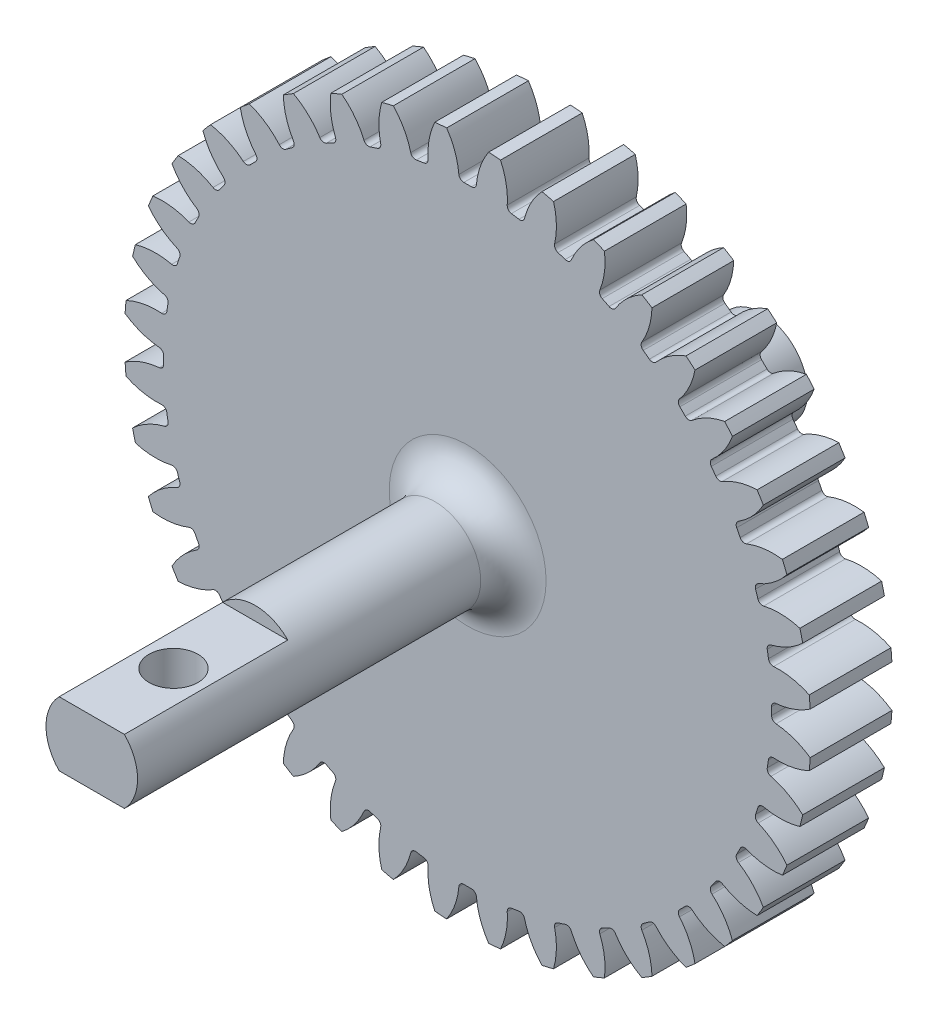
from build123d import *

# Parameters (mm, degrees)
SKETCH1_R                = 21
BOSS_EXTRUDE1_DEPTH      = 2.5
CUT_EXTRUDE1_DEPTH       = 31.116440693
FILLET1_R                = 0.3
CIRPATTERN1_COUNT        = 40
FILLET1_OF_CIRPATTERN1_R = 0.3
CUT_EXTRUDE2_DEPTH       = 31.061577586
CUT_EXTRUDE2_DEPTH_BACK  = 31.061577586
SHAFT_DEPTH              = 13
SHAFT_DEPTH_BACK         = 28
SKETCH5_R                = 2.8
SKETCH7_R                = 2.9
BOSS_EXTRUDE2_DEPTH      = 10
CUT_EXTRUDE5_DEPTH       = 10
SKETCH10_R               = 1.5
CUT_EXTRUDE6_DEPTH       = 8
SKETCH11_R               = 4.251118619
BOSS_EXTRUDE3_DEPTH      = 5
FILLET4_R                = 2
SKETCH12_R               = 5.023784791
SKETCH12_R_2             = 2.8
CUT_EXTRUDE7_DEPTH       = 10


with BuildPart() as part:
    # Sketch1 → Boss-Extrude1 (new, symmetric)
    with BuildSketch(Plane.XY):
        Circle(SKETCH1_R)
    extrude(amount=BOSS_EXTRUDE1_DEPTH, both=True)

    # Sketch3 → Cut-Extrude1 (cut, symmetric)
    with BuildSketch(Plane.XY.offset(2.5)):
        with BuildLine():
            ThreePointArc((-2.139593078, 21.895710572), (-0.970695217, 20.420263648), (-0.519675362, 18.592738839))
            ThreePointArc((-0.519675362, 18.592738839), (0, 18.6), (0.519675362, 18.592738839))
            ThreePointArc((0.519675362, 18.592738839), (0.970695217, 20.420263648), (2.139593078, 21.895710572))
            ThreePointArc((2.139593078, 21.895710572), (0, 22), (-2.139593078, 21.895710572))
        make_face()
    cut_extrude1 = extrude(amount=CUT_EXTRUDE1_DEPTH, both=True, mode=Mode.SUBTRACT)

    # Fillet1
    fillet1_edges = [part.edges().sort_by_distance(p)[0] for p in [
        (0.519675362, 18.592738839, 0),
        (-0.519675362, 18.592738839, 0),
    ]]
    fillet(fillet1_edges, radius=FILLET1_R)

    # CirPattern1: Cut-Extrude1 ×40 about axis
    cirpattern1_axis = Axis((0, 0, 2.5), (0, 0, -1))
    for i in range(1, CIRPATTERN1_COUNT):
        add(cut_extrude1.rotate(cirpattern1_axis, i * 360 / CIRPATTERN1_COUNT), mode=Mode.SUBTRACT)

    # Fillet1 of CirPattern1
    fillet1_of_cirpattern1_edges = [part.edges().sort_by_distance(p)[0] for p in [
        (3.42182245, 18.282536233, 0),
        (2.395267858, 18.445126508, 0),
        (6.239712913, 17.52215691, 0),
        (5.251231633, 17.843333947, 0),
        (8.903960935, 16.33032393, 0),
        (7.977892658, 16.802179285, 0),
        (11.348963889, 14.736384178, 0),
        (10.508111489, 15.347299206, 0),
        (13.514517686, 12.779585741, 0),
        (12.779585741, 13.514517686, 0),
        (15.347299206, 10.508111489, 0),
        (14.736384178, 11.348963889, 0),
        (16.802179285, 7.977892658, 0),
        (16.33032393, 8.903960935, 0),
        (17.843333947, 5.251231633, 0),
        (17.52215691, 6.239712913, 0),
        (18.445126508, 2.395267858, 0),
        (18.282536233, 3.42182245, 0),
        (18.592738839, -0.519675362, 0),
        (18.592738839, 0.519675362, 0),
        (18.282536233, -3.42182245, 0),
        (18.445126508, -2.395267858, 0),
        (17.52215691, -6.239712913, 0),
        (17.843333947, -5.251231633, 0),
        (16.33032393, -8.903960935, 0),
        (16.802179285, -7.977892658, 0),
        (14.736384178, -11.348963889, 0),
        (15.347299206, -10.508111489, 0),
        (12.779585741, -13.514517686, 0),
        (13.514517686, -12.779585741, 0),
        (10.508111489, -15.347299206, 0),
        (11.348963889, -14.736384178, 0),
        (7.977892658, -16.802179285, 0),
        (8.903960935, -16.33032393, 0),
        (5.251231633, -17.843333947, 0),
        (6.239712913, -17.52215691, 0),
        (2.395267858, -18.445126508, 0),
        (3.42182245, -18.282536233, 0),
        (-0.519675362, -18.592738839, 0),
        (0.519675362, -18.592738839, 0),
        (-3.42182245, -18.282536233, 0),
        (-2.395267858, -18.445126508, 0),
        (-6.239712913, -17.52215691, 0),
        (-5.251231633, -17.843333947, 0),
        (-8.903960935, -16.33032393, 0),
        (-7.977892658, -16.802179285, 0),
        (-11.348963889, -14.736384178, 0),
        (-10.508111489, -15.347299206, 0),
        (-13.514517686, -12.779585741, 0),
        (-12.779585741, -13.514517686, 0),
        (-15.347299206, -10.508111489, 0),
        (-14.736384178, -11.348963889, 0),
        (-16.802179285, -7.977892658, 0),
        (-16.33032393, -8.903960935, 0),
        (-17.843333947, -5.251231633, 0),
        (-17.52215691, -6.239712913, 0),
        (-18.445126508, -2.395267858, 0),
        (-18.282536233, -3.42182245, 0),
        (-18.592738839, 0.519675362, 0),
        (-18.592738839, -0.519675362, 0),
        (-18.282536233, 3.42182245, 0),
        (-18.445126508, 2.395267858, 0),
        (-17.52215691, 6.239712913, 0),
        (-17.843333947, 5.251231633, 0),
        (-16.33032393, 8.903960935, 0),
        (-16.802179285, 7.977892658, 0),
        (-14.736384178, 11.348963889, 0),
        (-15.347299206, 10.508111489, 0),
        (-12.779585741, 13.514517686, 0),
        (-13.514517686, 12.779585741, 0),
        (-10.508111489, 15.347299206, 0),
        (-11.348963889, 14.736384178, 0),
        (-7.977892658, 16.802179285, 0),
        (-8.903960935, 16.33032393, 0),
        (-5.251231633, 17.843333947, 0),
        (-6.239712913, 17.52215691, 0),
        (-2.395267858, 18.445126508, 0),
        (-3.42182245, 18.282536233, 0),
    ]]
    fillet(fillet1_of_cirpattern1_edges, radius=FILLET1_OF_CIRPATTERN1_R)

    # Sketch4 → Cut-Extrude2 (cut, two sides: drawn at the far end of the back side and taken through both)
    with BuildSketch(Plane.XY.offset(2.5).offset(-CUT_EXTRUDE2_DEPTH_BACK)):
        with BuildLine():
            Line((-1.368393218, 2.5), (1.368393218, 2.5))
            ThreePointArc((1.368393218, 2.5), (0, -2.85), (-1.368393218, 2.5))
        make_face()
    extrude(amount=CUT_EXTRUDE2_DEPTH + CUT_EXTRUDE2_DEPTH_BACK, mode=Mode.SUBTRACT)

    # Sketch5 → Shaft (add, two sides: drawn at the far end of the back side and taken through both)
    with BuildSketch(Plane(origin=(0, 0, -2.5), x_dir=(-1, 0, 0), z_dir=(0, 0, -1)).offset(-SHAFT_DEPTH_BACK)):
        Circle(SKETCH5_R)
    extrude(amount=SHAFT_DEPTH + SHAFT_DEPTH_BACK)

    # Sketch7 → Boss-Extrude2 (add)
    with BuildSketch(Plane.XY.offset(25.5)):
        Circle(SKETCH7_R)
    extrude(amount=-BOSS_EXTRUDE2_DEPTH)

    # Sketch9 → Cut-Extrude5 (cut)
    with BuildSketch(Plane.XY.offset(25.5)):
        with BuildLine():
            Line((-2.2683161, 1.963349707), (2.2683161, 1.963349707))
            ThreePointArc((2.2683161, 1.963349707), (0, 3), (-2.2683161, 1.963349707))
        make_face()
        with BuildLine():
            Line((-2.2683161, -1.963349707), (2.2683161, -1.963349707))
            ThreePointArc((2.2683161, -1.963349707), (0, -3), (-2.2683161, -1.963349707))
        make_face()
    extrude(amount=-CUT_EXTRUDE5_DEPTH, mode=Mode.SUBTRACT)

    # Sketch10 → Cut-Extrude6 (cut)
    with BuildSketch(Plane(origin=(0, 1.963349707, 0), x_dir=(1, 0, 0), z_dir=(0, 1, 0))):
        with Locations((0, -20.5)):
            Circle(SKETCH10_R)
    extrude(amount=-CUT_EXTRUDE6_DEPTH, mode=Mode.SUBTRACT)

    # Sketch11 → Boss-Extrude3 (add)
    with BuildSketch(Plane(origin=(0, 0, -2.5), x_dir=(-1, 0, 0), z_dir=(0, 0, -1))):
        Circle(SKETCH11_R)
    extrude(amount=-BOSS_EXTRUDE3_DEPTH)

    # Fillet4
    fillet4_edges = [part.edges().sort_by_distance(p)[0] for p in [
        (2.8, 0, -2.5),
        (2.8, 0, 2.5),
    ]]
    fillet(fillet4_edges, radius=FILLET4_R)

    # Sketch12 → Cut-Extrude7 (cut)
    with BuildSketch(Plane.XY.offset(15.5)):
        Circle(SKETCH12_R)
        Circle(SKETCH12_R_2, mode=Mode.SUBTRACT)
    extrude(amount=CUT_EXTRUDE7_DEPTH, mode=Mode.SUBTRACT)


solid = part.part
